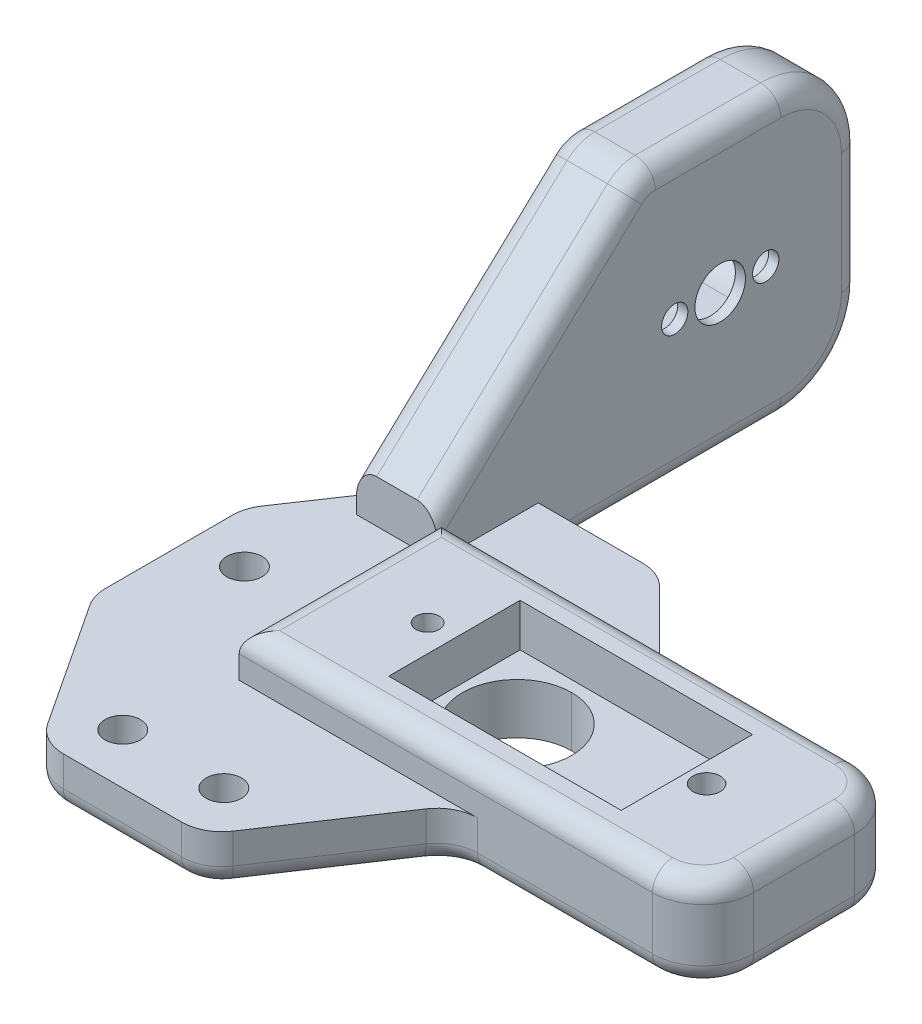
from build123d import *

# Parameters (mm, degrees)
BOSS_EXTRUDE1_DEPTH  = 5
SKETCH3_R            = 1.75
SKETCH3_W            = 10.8
SKETCH3_H            = 10.8
CUT_EXTRUDE1_DEPTH   = 52.721310243
FILLET1_R            = 5.4
FILLET2_R            = 5.4
SKETCH4_W            = 35
SKETCH4_H            = 20
SKETCH4_W_2          = 23
SKETCH4_H_2          = 13
BOSS_EXTRUDE2_DEPTH  = 4.25
SKETCH5_W            = 10.6
SKETCH5_H            = 20
CUT_EXTRUDE2_DEPTH   = 52.721310243
FILLET4_R            = 4
SKETCH6_W            = 8
SKETCH6_H            = 28
BOSS_EXTRUDE3_DEPTH  = 32
SKETCH7_R            = 1.3
SKETCH7_R_2          = 2.5
CUT_EXTRUDE3_DEPTH   = 32
FILLET5_R            = 8
BOSS_EXTRUDE4_DEPTH  = 8
SKETCH9_W            = 14
SKETCH9_H            = 7
CUT_EXTRUDE4_DEPTH   = 7
FILLET6_R            = 3.5
FILLET7_R            = 3.5
CUT_EXTRUDE5_DEPTH   = 8
FILLET8_R            = 4
BOSS_EXTRUDE6_START  = -9.25
BOSS_EXTRUDE6_DEPTH  = 9.25
SKETCH13_W           = 5.3
SKETCH13_H           = 13
SKETCH13_R           = 1.15
BOSS_EXTRUDE9_DEPTH  = 4.25
SKETCH14_R           = 1.35
CUT_EXTRUDE6_DEPTH   = 4.25
SKETCH15_W           = 7
SKETCH15_H           = 20
BOSS_EXTRUDE10_DEPTH = 9.25
FILLET11_R           = 5
FILLET12_R           = 2
SKETCH16_W           = 5.3
SKETCH16_H           = 13
CUT_EXTRUDE7_DEPTH   = 4.25


# Some blends are built 0.0001 mm under size
with BuildPart() as part:
    # Sketch2 → Boss-Extrude1 (new body)
    with BuildSketch(Plane(origin=(0, 0, 0), x_dir=(1, 0, 0), z_dir=(0, 1, 0))):
        Polygon((-15.080737936, 5.050942453), (-4.998489886, 19.998489886), (11.001510114, 19.998489886), (21, 10), (45, 10), (45, -10), (20.844876991, -10), (10.843650133, -25.001878594), (-5.156349867, -25.001878594), (-15.080737936, -9.949057547), align=None)
    extrude(amount=BOSS_EXTRUDE1_DEPTH)

    # Sketch3 → Cut-Extrude1 (cut, through all)
    with BuildSketch(Plane(origin=(0, 5, 0), x_dir=(1, 0, 0), z_dir=(0, 1, 0))):
        with Locations(Location((-10.080737936, 0, 0), (0, 0, 270))):
            Circle(SKETCH3_R)
        with Locations(Location((-2.117930473, -20.001878594, 0), (0, 0, 270))):
            Circle(SKETCH3_R)
        with Locations(Location((7.882069527, -20.001878594, 0), (0, 0, 270))):
            Circle(SKETCH3_R)
        with Locations((16.9, 0)):
            Rectangle(SKETCH3_W, SKETCH3_H)
    extrude(amount=-CUT_EXTRUDE1_DEPTH, mode=Mode.SUBTRACT)

    # Fillet1
    fillet1_edges = [part.edges().sort_by_distance(p)[0] for p in [
        (11.5, 2.5, 5.4),
        (11.5, 2.5, -5.4),
    ]]
    fillet(fillet1_edges, radius=FILLET1_R - 0.0001)  # a hair under: the kernel refuses the full size

    # Fillet2
    # the kernel refuses this fillet: 5.4 mm, written as the material it adds along each edge
    with BuildSketch(Plane(origin=(22.3, 5, -5.4), x_dir=(0, 0, 1), z_dir=(0, -1, 0)), Plane(origin=(22.3, 5, 5.4), x_dir=(-1, 0, 0), z_dir=(0, -1, 0))) as fillet2_piece_1:
        with BuildLine():
            CenterArc((FILLET2_R, FILLET2_R), FILLET2_R, 180, 90)
            Line((0, FILLET2_R), (0, 0))
            Line((0, 0), (FILLET2_R, 0))
        make_face()
    extrude(amount=5)
    # the kernel refuses this fillet: 5.4 mm, written as the material it takes off along each edge

    # Sketch4 → Boss-Extrude2 (add)
    with BuildSketch(Plane(origin=(0, 5, 0), x_dir=(1, 0, 0), z_dir=(0, 1, 0))):
        with Locations((16.9, 0)):
            Rectangle(SKETCH4_W, SKETCH4_H)
        with Locations((16.9, 0)):
            Rectangle(SKETCH4_W_2, SKETCH4_H_2, mode=Mode.SUBTRACT)
    extrude(amount=BOSS_EXTRUDE2_DEPTH)

    # Sketch5 → Cut-Extrude2 (cut, through all)
    with BuildSketch(Plane(origin=(0, 5, 0), x_dir=(1, 0, 0), z_dir=(0, 1, 0))):
        with Locations((39.7, 0)):
            Rectangle(SKETCH5_W, SKETCH5_H)
    extrude(amount=-CUT_EXTRUDE2_DEPTH, mode=Mode.SUBTRACT)

    # Fillet4
    fillet4_edges = [part.edges().sort_by_distance(p)[0] for p in [
        (34.4, 4.625, 10),
        (34.4, 4.625, -10),
    ]]
    fillet(fillet4_edges, radius=FILLET4_R)

    # Sketch6 → Boss-Extrude3 (add)
    with BuildSketch(Plane(origin=(0, 0, -19.998489886), x_dir=(-1, 0, 0), z_dir=(0, 0, -1))):
        with Locations((4.998489886, 14)):
            Rectangle(SKETCH6_W, SKETCH6_H)
    extrude(amount=BOSS_EXTRUDE3_DEPTH)

    # Sketch7 → Cut-Extrude3 (cut)
    with BuildSketch(Plane(origin=(-0.998489886, 0, 0), x_dir=(0, 0, -1), z_dir=(1, 0, 0))):
        with Locations(Location((33.498489886, 14, 0), (0, 0, 90))):
            Circle(SKETCH7_R)
        with Locations(Location((37.998489886, 14, 0), (0, 0, 90))):
            Circle(SKETCH7_R_2)
        with Locations(Location((42.498489886, 14, 0), (0, 0, 90))):
            Circle(SKETCH7_R)
    extrude(amount=-CUT_EXTRUDE3_DEPTH, mode=Mode.SUBTRACT)

    # Fillet5
    fillet5_edges = [part.edges().sort_by_distance(p)[0] for p in [
        (-4.998489886, 0, -51.998489886),
        (-4.998489886, 28, -51.998489886),
    ]]
    fillet(fillet5_edges, radius=FILLET5_R)

    # Sketch8 → Boss-Extrude4 (add)
    with BuildSketch(Plane(origin=(-0.998489886, 0, 0), x_dir=(0, 0, -1), z_dir=(1, 0, 0))):
        Polygon((10, 5), (10, 9.25), (19.998489886, 28), (19.998489886, 5), (19.998489886, 0), (10, 0), align=None)
    extrude(amount=-BOSS_EXTRUDE4_DEPTH)

    # Sketch9 → Cut-Extrude4 (cut)
    with BuildSketch(Plane.ZY.offset(8.998489886)):
        with Locations((-37.998489886, 14)):
            Rectangle(SKETCH9_W, SKETCH9_H)
    extrude(amount=-CUT_EXTRUDE4_DEPTH, mode=Mode.SUBTRACT)

    # Fillet6
    fillet6_edges = [part.edges().sort_by_distance(p)[0] for p in [
        (-5.498489886, 10.5, -44.998489886),
        (-5.498489886, 17.5, -44.998489886),
    ]]
    fillet(fillet6_edges, radius=FILLET6_R - 0.0001)  # a hair under: the kernel refuses the full size

    # Fillet7
    fillet7_edges = [part.edges().sort_by_distance(p)[0] for p in [
        (-5.498489886, 17.5, -30.998489886),
        (-5.498489886, 10.5, -30.998489886),
    ]]
    fillet(fillet7_edges, radius=FILLET7_R - 0.0001)  # a hair under: the kernel refuses the full size

    # Sketch10 → Cut-Extrude5 (cut)
    with BuildSketch(Plane.ZY.offset(8.998489886)):
        Polygon((-19.998489886, 28), (-10, 9.25), (-29.998489886, 28), align=None)
    extrude(amount=-CUT_EXTRUDE5_DEPTH, mode=Mode.SUBTRACT)

    # Fillet8
    fillet8_edges = [part.edges().sort_by_distance(p)[0] for p in [
        (-15.080737936, 2.5, -5.050942453),
        (11.001510114, 2.5, -19.998489886),
        (21, 2.5, -10),
        (20.844876991, 2.5, 10),
        (10.843650133, 2.5, 25.001878594),
        (-5.156349867, 2.5, 25.001878594),
        (-15.080737936, 2.5, 9.949057547),
        (-8.998489886, 2.5, -14.068246012),
        (-4.998489886, 28, -29.998489886),
    ]]
    fillet(fillet8_edges, radius=FILLET8_R)

    # Sketch12 → Boss-Extrude6 (add)
    with BuildSketch(Plane(origin=(0, 9.25, 0), x_dir=(1, 0, 0), z_dir=(0, 1, 0)).offset(BOSS_EXTRUDE6_START)):
        with BuildLine():
            Line((34.4, -6), (34.4, 6))
            ThreePointArc((34.4, 6), (33.228427125, 8.828427125), (30.4, 10))
            Line((30.4, 10), (38.3, 10))
            Line((38.3, 10), (38.3, -10))
            Line((38.3, -10), (30.4, -10))
            ThreePointArc((30.4, -10), (33.228427125, -8.828427125), (34.4, -6))
        make_face()
    extrude(amount=BOSS_EXTRUDE6_DEPTH)

    # Sketch13 → Boss-Extrude9 (add)
    with BuildSketch(Plane(origin=(0, 9.25, 0), x_dir=(1, 0, 0), z_dir=(0, 1, 0))):
        with Locations((8.05, 0)):
            Rectangle(SKETCH13_W, SKETCH13_H)
        with Locations(Location((8.05, 0, 0), (0, 0, 270))):
            Circle(SKETCH13_R, mode=Mode.SUBTRACT)
    extrude(amount=-BOSS_EXTRUDE9_DEPTH)

    # Sketch14 → Cut-Extrude6 (cut)
    with BuildSketch(Plane(origin=(0, 9.25, 0), x_dir=(1, 0, 0), z_dir=(0, 1, 0))):
        with Locations(Location((35.65, 0, 0), (0, 0, 270))):
            Circle(SKETCH14_R)
    extrude(amount=-CUT_EXTRUDE6_DEPTH, mode=Mode.SUBTRACT)

    # Sketch15 → Boss-Extrude10 (add)
    with BuildSketch(Plane(origin=(0, 9.25, 0), x_dir=(1, 0, 0), z_dir=(0, 1, 0))):
        with Locations((41.8, 0)):
            Rectangle(SKETCH15_W, SKETCH15_H)
    extrude(amount=-BOSS_EXTRUDE10_DEPTH)

    # Fillet11
    fillet11_edges = [part.edges().sort_by_distance(p)[0] for p in [
        (45.3, 4.625, -10),
        (45.3, 4.625, 10),
    ]]
    fillet(fillet11_edges, radius=FILLET11_R)

    # Fillet12
    fillet12_edges = [part.edges().sort_by_distance(p)[0] for p in [
        (-0.998489886, 18.084022871, -19.422246242),
        (-0.998489886, 27.719689703, -30.109343993),
        (-0.998489886, 28, -37.789428414),
        (-0.998489886, 25.656854249, -49.655344135),
        (-0.998489886, 0, -31.998489886),
        (-0.998489886, 2.343145751, -49.655344135),
        (19.85, 9.25, 10),
        (43.835533906, 0, 8.535533906),
        (43.835533906, 9.25, 8.535533906),
        (45.3, 9.25, 0),
        (45.3, 0, 0),
        (43.835533906, 0, -8.535533906),
        (43.835533906, 9.25, -8.535533906),
        (4.173082989, 0, -19.998489886),
        (10.875389594, 0, -19.694008016),
        (16.000755057, 0, -14.999244943),
        (21.12612052, 0, -10.30448187),
        (31.478427125, 0, -10),
        (-8.998489886, 18.084022871, -19.422246242),
        (-8.998489886, 27.719689703, -30.109343993),
        (-8.998489886, 28, -37.789428414),
        (-8.998489886, 25.656854249, -49.655344135),
        (-8.998489886, 14, -51.998489886),
        (-8.998489886, 2.343145751, -49.655344135),
        (-8.998489886, 0, -29.644829312),
        (-9.173270862, 0, -14.121681919),
        (-12.039613911, 0, -9.559594232),
        (-14.905956959, 0, -4.997506546),
        (-15.080737936, 0, 2.460546613),
        (-14.912057682, 0, 9.898455808),
        (-10.381093541, 0, 17.077245761),
        (-4.898882191, 0, 24.523738894),
        (2.850236962, 0, 25.001878594),
        (10.590345847, 0, 24.528575877),
        (15.844263562, 0, 17.500939297),
        (21.098181276, 0, 10.473302717),
        (31.642807528, 0, 10),
        (-0.998489886, 14, -51.998489886),
        (-0.6, 9.25, 0),
        (19.85, 9.25, -10),
    ]]
    fillet(fillet12_edges, radius=FILLET12_R)

    # Sketch16 → Cut-Extrude7 (cut)
    with BuildSketch(Plane(origin=(0, 9.25, 0), x_dir=(1, 0, 0), z_dir=(0, 1, 0))):
        with Locations((31.05, 0)):
            Rectangle(SKETCH16_W, SKETCH16_H)
    extrude(amount=-CUT_EXTRUDE7_DEPTH, mode=Mode.SUBTRACT)


solid = part.part
